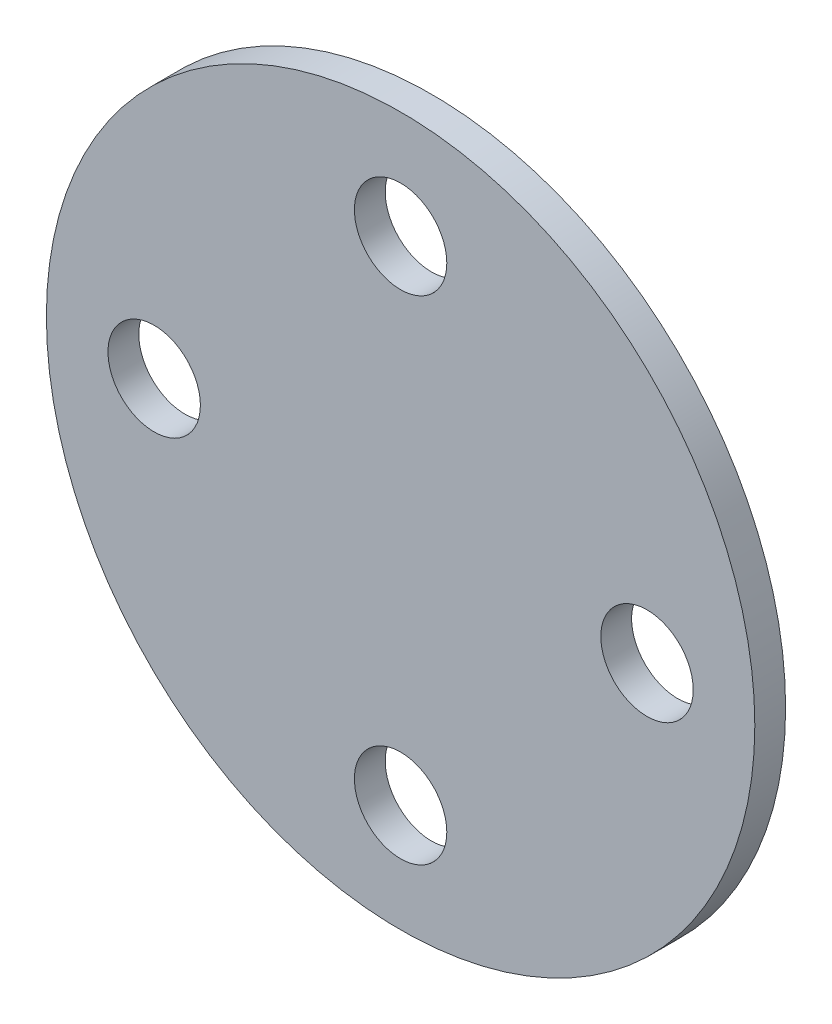
from build123d import *

# Parameters (mm, degrees)
SKETCH_1_R          = 23
EXTRUDE_1_DEPTH     = 2
SKETCH_2_R          = 3
CUT_EXTRUDE_1_DEPTH = 33.588341474


with BuildPart() as part:
    # 草图1 → 凸台-拉伸1 (new body)
    with BuildSketch(Plane.XY):
        Circle(SKETCH_1_R)
    extrude(amount=EXTRUDE_1_DEPTH)

    # 草图2 → 切除-拉伸1 (cut, through all)
    with BuildSketch(Plane.XY.offset(2)):
        with Locations((16, 0)):
            Circle(SKETCH_2_R)
        with Locations((0, 16)):
            Circle(SKETCH_2_R)
        with Locations((-16, 0)):
            Circle(SKETCH_2_R)
        with Locations((0, -16)):
            Circle(SKETCH_2_R)
    extrude(amount=-CUT_EXTRUDE_1_DEPTH, mode=Mode.SUBTRACT)


solid = part.part
